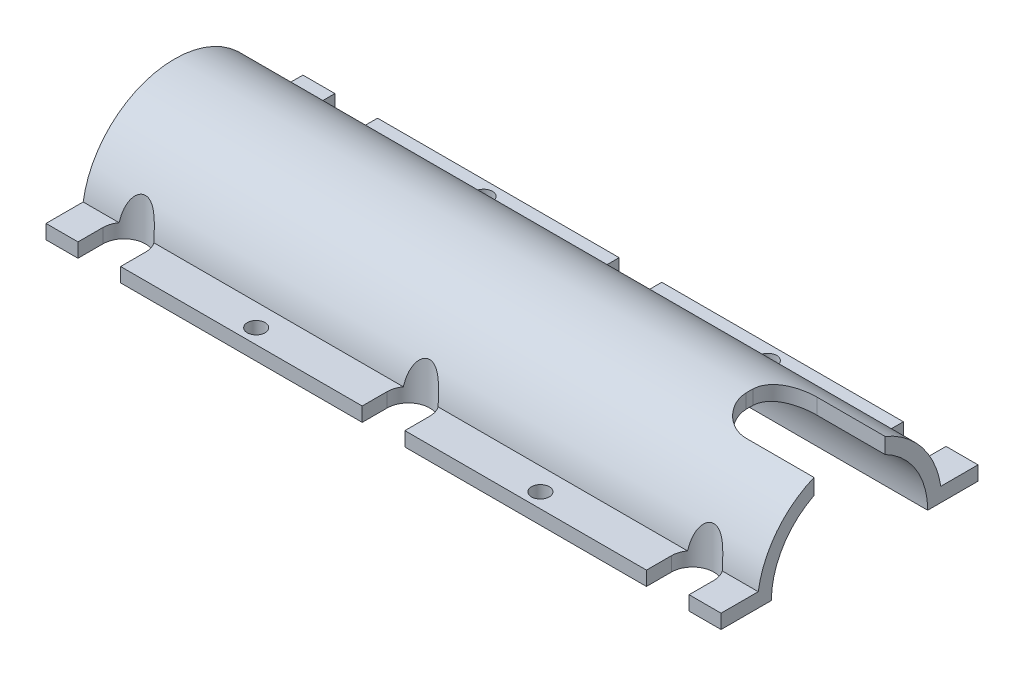
from build123d import *

# Parameters (mm, degrees)
EXTRUDE_1_DEPTH          = 95
CUT_EXTRUDE_1_DEPTH      = 98.328840189
CUT_EXTRUDE_1_DEPTH_BACK = 98.328840189
SKETCH_2_R               = 1.25
CUT_EXTRUDE_2_DEPTH      = 98.575312762


with BuildPart() as part:
    # Эскиз1 → Бобышка-Вытянуть1 (new body)
    with BuildSketch(Plane(origin=(0, 0, 0), x_dir=(0, 0, -1), z_dir=(1, 0, 0))):
        with BuildLine():
            Line((11, 0), (18.079487192, 0))
            Line((18.079487192, 0), (18.079487192, 2))
            Line((18.079487192, 2), (12.848104212, 2))
            ThreePointArc((12.848104212, 2), (0.000220895, 13.002837452), (-12.848036252, 2.000436531))
            Line((-12.848036252, 2.000436531), (-18.079487192, 2))
            Line((-18.079487192, 2), (-18.079487192, 0))
            Line((-18.079487192, 0), (-11, 0))
            ThreePointArc((-11, 0), (0, 11), (11, 0))
        make_face()
    extrude(amount=EXTRUDE_1_DEPTH)

    # Эскиз2 → Вырез-Вытянуть1 (cut, two sides: drawn at the far end of the back side and taken through both)
    with BuildSketch(Plane(origin=(0, 2.001508604, 0.000167013), x_dir=(1, 0, 0), z_dir=(0, 0.9999999965185792, 8.344364312112642e-05)).offset(-CUT_EXTRUDE_1_DEPTH_BACK)):
        with Locations((27.5, -16)):
            Circle(SKETCH_2_R)
        with Locations((67.5, -16)):
            Circle(SKETCH_2_R)
        with Locations((67.5, 16)):
            Circle(SKETCH_2_R)
        with Locations((27.5, 16)):
            Circle(SKETCH_2_R)
        with BuildLine():
            Line((4.5, -14.579320241), (4.5, -18.29882224))
            Line((4.5, -18.29882224), (10.5, -18.29882224))
            Line((10.5, -18.29882224), (10.5, -14.579320241))
            ThreePointArc((10.5, -14.579320241), (7.5, -11.579320241), (4.5, -14.579320241))
        make_face()
        with BuildLine():
            Line((50.5, -18.29882224), (50.5, -14.579320241))
            ThreePointArc((50.5, -14.579320241), (47.5, -11.579320241), (44.5, -14.579320241))
            Line((44.5, -14.579320241), (44.5, -18.29882224))
            Line((44.5, -18.29882224), (50.5, -18.29882224))
        make_face()
        with BuildLine():
            Line((90.5, -18.29882224), (90.5, -14.579320241))
            ThreePointArc((90.5, -14.579320241), (87.5, -11.579320241), (84.5, -14.579320241))
            Line((84.5, -14.579320241), (84.5, -18.29882224))
            Line((84.5, -18.29882224), (90.5, -18.29882224))
        make_face()
        with BuildLine():
            Line((84.5, 18.29882224), (90.5, 18.29882224))
            Line((90.5, 18.29882224), (90.5, 14.579320241))
            ThreePointArc((90.5, 14.579320241), (87.5, 11.579320241), (84.5, 14.579320241))
            Line((84.5, 14.579320241), (84.5, 18.29882224))
        make_face()
        with BuildLine():
            Line((44.5, 18.29882224), (50.5, 18.29882224))
            Line((50.5, 18.29882224), (50.5, 14.579320241))
            ThreePointArc((50.5, 14.579320241), (47.5, 11.579320241), (44.5, 14.579320241))
            Line((44.5, 14.579320241), (44.5, 18.29882224))
        make_face()
        with BuildLine():
            Line((4.5, 18.29882224), (10.5, 18.29882224))
            Line((10.5, 18.29882224), (10.5, 14.579320241))
            ThreePointArc((10.5, 14.579320241), (7.5, 11.579320241), (4.5, 14.579320241))
            Line((4.5, 14.579320241), (4.5, 18.29882224))
        make_face()
    extrude(amount=CUT_EXTRUDE_1_DEPTH + CUT_EXTRUDE_1_DEPTH_BACK, mode=Mode.SUBTRACT)

    # Эскиз3 → Вырез-Вытянуть2 (cut, through all)
    with BuildSketch(Plane.XZ):
        with BuildLine():
            Line((85.409616901, 5), (95, 5))
            Line((95, 5), (95, -5))
            Line((95, -5), (85.409616901, -5))
            ThreePointArc((85.409616901, -5), (82.227636386, -3.681980515), (80.909616901, -0.5))
            Line((80.909616901, -0.5), (80.909616901, 0.5))
            ThreePointArc((80.909616901, 0.5), (82.227636386, 3.681980515), (85.409616901, 5))
        make_face()
    extrude(amount=-CUT_EXTRUDE_2_DEPTH, mode=Mode.SUBTRACT)


solid = part.part
